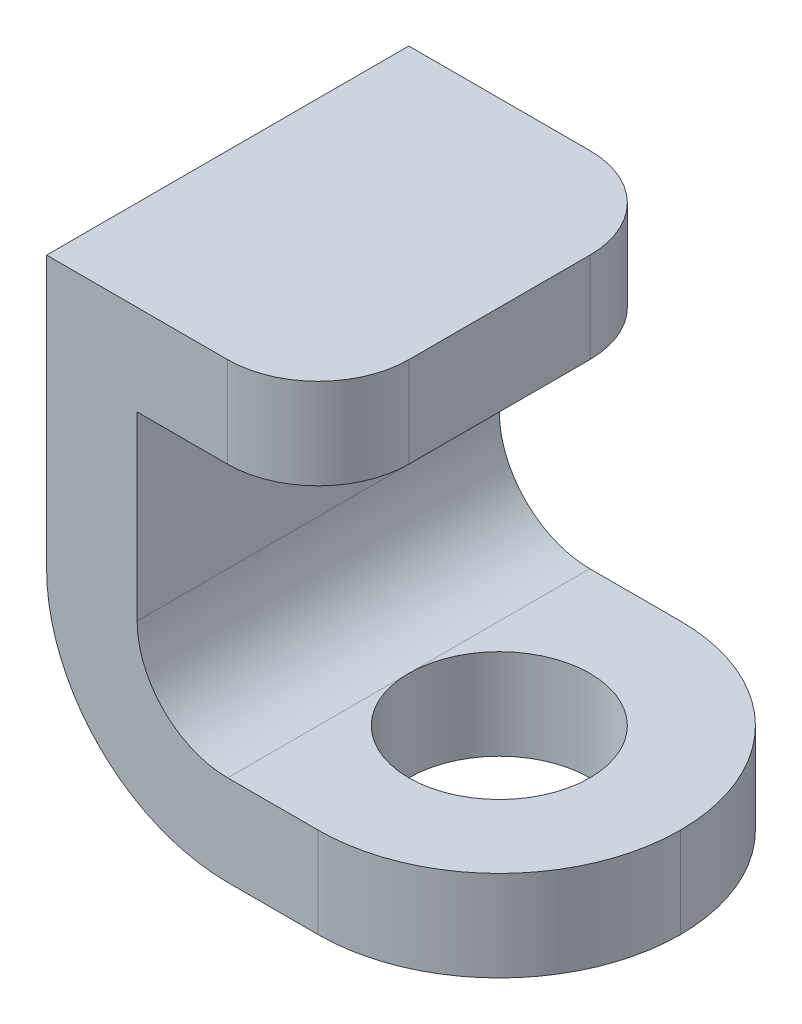
from build123d import *

# Parameters (mm, degrees)
SKETCH_2_W          = 5
SKETCH_2_H          = 5
SKETCH_2_W_2        = 10
SKETCH_2_H_2        = 15
EXTRUDE_1_DEPTH     = 20
FILLET_1_R          = 10
FILLET_2_R          = 5
SKETCH_3_R          = 5
CUT_EXTRUDE_1_DEPTH = 38.749172176


with BuildPart() as part:
    # 草圖2 → 填料-伸長1 (new body)
    with BuildSketch(Plane.XY):
        with Locations((2.5, -2.5)):
            Rectangle(SKETCH_2_W, SKETCH_2_H)
        with Locations((10, -2.5)):
            Rectangle(SKETCH_2_W_2, SKETCH_2_H)
        with Locations((2.5, -12.5)):
            Rectangle(SKETCH_2_W, SKETCH_2_H_2)
        Polygon((5, -20), (0, -20), (0, -25), (25, -25), (25, -20), align=None)
    extrude(amount=-EXTRUDE_1_DEPTH)

    # 圓角1
    fillet_1_edges = [part.edges().sort_by_distance(p)[0] for p in [
        (25, -22.5, 0),
        (25, -22.5, -20),
        (0, -25, -10),
    ]]
    fillet(fillet_1_edges, radius=FILLET_1_R - 0.0001)  # a hair under: the kernel refuses the full size

    # 圓角2
    fillet_2_edges = [part.edges().sort_by_distance(p)[0] for p in [
        (15, -2.5, -20),
        (15, -2.5, 0),
        (5, -20, -10),
    ]]
    fillet(fillet_2_edges, radius=FILLET_2_R)

    # 草圖3 → 除料-伸長1 (cut, through all)
    with BuildSketch(Plane(origin=(0, -20, 0), x_dir=(1, 0, 0), z_dir=(0, 1, 0))):
        with Locations(Location((15, 10, 0), (0, 0, 180))):
            Circle(SKETCH_3_R)
    extrude(amount=-CUT_EXTRUDE_1_DEPTH, mode=Mode.SUBTRACT)


solid = part.part
